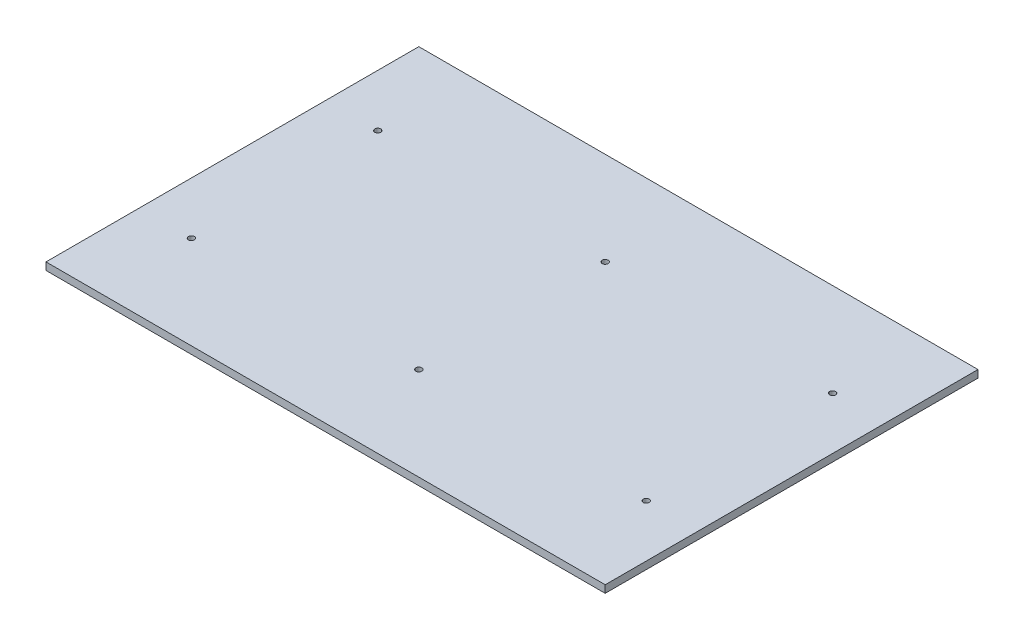
from build123d import *

# Parameters (mm, degrees)
SKETCH1_W           = 750
SKETCH1_H           = 500
BOSS_EXTRUDE1_DEPTH = 10
SKETCH2_R           = 4
CUT_EXTRUDE1_DEPTH  = 10
SKETCH3_R           = 4
CUT_EXTRUDE2_DEPTH  = 10
SKETCH4_R           = 4
CUT_EXTRUDE3_DEPTH  = 10
SKETCH5_R           = 4
CUT_EXTRUDE4_DEPTH  = 10
SKETCH6_R           = 4
CUT_EXTRUDE5_DEPTH  = 10
SKETCH7_R           = 4
CUT_EXTRUDE6_DEPTH  = 10


with BuildPart() as part:
    # Sketch1 → Boss-Extrude1 (new body)
    with BuildSketch(Plane(origin=(0, 0, 0), x_dir=(1, 0, 0), z_dir=(0, 1, 0))):
        Rectangle(SKETCH1_W, SKETCH1_H)
    extrude(amount=BOSS_EXTRUDE1_DEPTH)

    # Sketch2 → Cut-Extrude1 (cut)
    with BuildSketch(Plane(origin=(0, 10, 0), x_dir=(1, 0, 0), z_dir=(0, 1, 0))):
        with Locations((305, 125)):
            Circle(SKETCH2_R)
    extrude(amount=-CUT_EXTRUDE1_DEPTH, mode=Mode.SUBTRACT)

    # Sketch3 → Cut-Extrude2 (cut)
    with BuildSketch(Plane(origin=(0, 10, 0), x_dir=(1, 0, 0), z_dir=(0, 1, 0))):
        with Locations((305, -125)):
            Circle(SKETCH3_R)
    extrude(amount=-CUT_EXTRUDE2_DEPTH, mode=Mode.SUBTRACT)

    # Sketch4 → Cut-Extrude3 (cut)
    with BuildSketch(Plane(origin=(0, 10, 0), x_dir=(1, 0, 0), z_dir=(0, 1, 0))):
        with Locations((0, 125)):
            Circle(SKETCH4_R)
    extrude(amount=-CUT_EXTRUDE3_DEPTH, mode=Mode.SUBTRACT)

    # Sketch5 → Cut-Extrude4 (cut)
    with BuildSketch(Plane(origin=(0, 10, 0), x_dir=(1, 0, 0), z_dir=(0, 1, 0))):
        with Locations((0, -125)):
            Circle(SKETCH5_R)
    extrude(amount=-CUT_EXTRUDE4_DEPTH, mode=Mode.SUBTRACT)

    # Sketch6 → Cut-Extrude5 (cut)
    with BuildSketch(Plane(origin=(0, 10, 0), x_dir=(1, 0, 0), z_dir=(0, 1, 0))):
        with Locations((-305, 125)):
            Circle(SKETCH6_R)
    extrude(amount=-CUT_EXTRUDE5_DEPTH, mode=Mode.SUBTRACT)

    # Sketch7 → Cut-Extrude6 (cut)
    with BuildSketch(Plane(origin=(0, 10, 0), x_dir=(1, 0, 0), z_dir=(0, 1, 0))):
        with Locations((-305, -125)):
            Circle(SKETCH7_R)
    extrude(amount=-CUT_EXTRUDE6_DEPTH, mode=Mode.SUBTRACT)


solid = part.part
